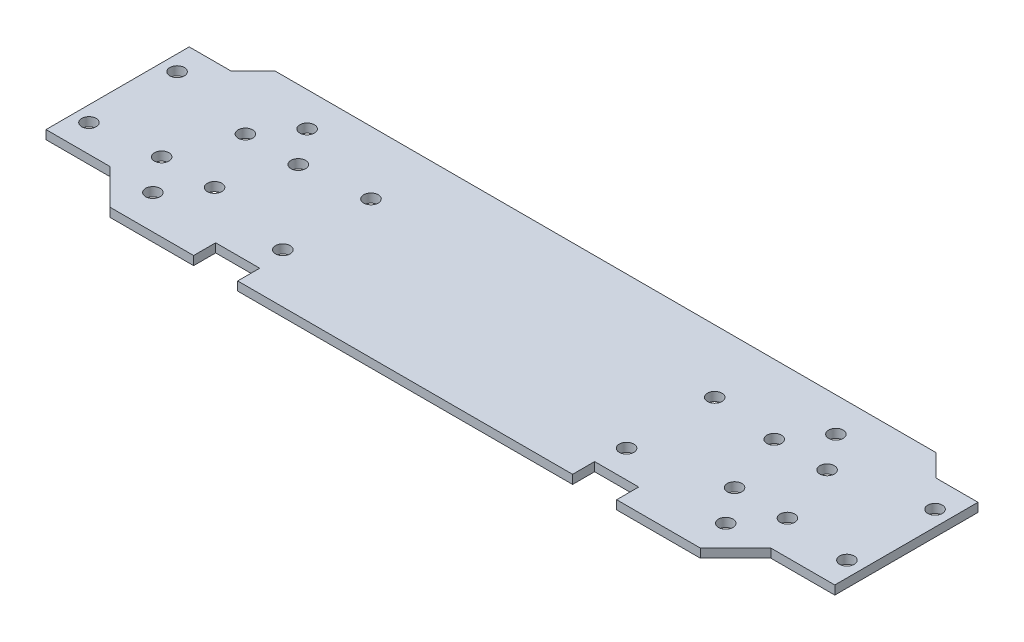
from build123d import *

# Parameters (mm, degrees)
SKETCH_1_W          = 150
SKETCH_1_H          = 45.5
EXTRUDE_1_DEPTH     = 2
CUT_EXTRUDE_1_REACH = 80.4
SKETCH_2_R          = 1.65
CUT_EXTRUDE_2_REACH = 80.4
SKETCH_4_W          = 10
SKETCH_4_H          = 5
CHAMFER_1_SIZE      = 8
SKETCH_6_W          = 14.5
SKETCH_6_H          = 32.5
EXTRUDE_2_DEPTH     = 2
CUT_EXTRUDE_3_REACH = 94.368
SKETCH_7_R          = 1.65
CHAMFER_2_SIZE      = 5


with BuildPart() as part:
    # 草图1 → 凸台-拉伸1 (new body)
    with BuildSketch(Plane(origin=(0, 0, 0), x_dir=(1, 0, 0), z_dir=(0, 1, 0))):
        Rectangle(SKETCH_1_W, SKETCH_1_H)
    extrude(amount=EXTRUDE_1_DEPTH)

    # 草图2 → 切除-拉伸1 (cut, up to next)
    with BuildSketch(Plane(origin=(0, 2, 0), x_dir=(1, 0, 0), z_dir=(0, 1, 0)), mode=Mode.PRIVATE) as cut_extrude_1_sk1:
        with Locations(Location((-60, 15, 0), (0, 0, 270))):
            Circle(SKETCH_2_R)
    cut_extrude_1_tool1 = extrude(cut_extrude_1_sk1.sketch, amount=-CUT_EXTRUDE_1_REACH, mode=Mode.PRIVATE) & part.part
    # 草图2 → 切除-拉伸1 (cut, up to next)
    with BuildSketch(Plane(origin=(0, 2, 0), x_dir=(1, 0, 0), z_dir=(0, 1, 0)), mode=Mode.PRIVATE) as cut_extrude_1_sk2:
        with Locations(Location((-66, 7, 0), (0, 0, 270))):
            Circle(SKETCH_2_R)
    cut_extrude_1_tool2 = extrude(cut_extrude_1_sk2.sketch, amount=-CUT_EXTRUDE_1_REACH, mode=Mode.PRIVATE) & part.part
    # 草图2 → 切除-拉伸1 (cut, up to next)
    with BuildSketch(Plane(origin=(0, 2, 0), x_dir=(1, 0, 0), z_dir=(0, 1, 0)), mode=Mode.PRIVATE) as cut_extrude_1_sk3:
        with Locations(Location((-54, 7, 0), (0, 0, 270))):
            Circle(SKETCH_2_R)
    cut_extrude_1_tool3 = extrude(cut_extrude_1_sk3.sketch, amount=-CUT_EXTRUDE_1_REACH, mode=Mode.PRIVATE) & part.part
    # 草图2 → 切除-拉伸1 (cut, up to next)
    with BuildSketch(Plane(origin=(0, 2, 0), x_dir=(1, 0, 0), z_dir=(0, 1, 0)), mode=Mode.PRIVATE) as cut_extrude_1_sk4:
        with Locations(Location((-71, -7, 0), (0, 0, 270))):
            Circle(SKETCH_2_R)
    cut_extrude_1_tool4 = extrude(cut_extrude_1_sk4.sketch, amount=-CUT_EXTRUDE_1_REACH, mode=Mode.PRIVATE) & part.part
    # 草图2 → 切除-拉伸1 (cut, up to next)
    with BuildSketch(Plane(origin=(0, 2, 0), x_dir=(1, 0, 0), z_dir=(0, 1, 0)), mode=Mode.PRIVATE) as cut_extrude_1_sk5:
        with Locations(Location((-59, -7, 0), (0, 0, 270))):
            Circle(SKETCH_2_R)
    cut_extrude_1_tool5 = extrude(cut_extrude_1_sk5.sketch, amount=-CUT_EXTRUDE_1_REACH, mode=Mode.PRIVATE) & part.part
    # 草图2 → 切除-拉伸1 (cut, up to next)
    with BuildSketch(Plane(origin=(0, 2, 0), x_dir=(1, 0, 0), z_dir=(0, 1, 0)), mode=Mode.PRIVATE) as cut_extrude_1_sk6:
        with Locations(Location((-65, -15, 0), (0, 0, 270))):
            Circle(SKETCH_2_R)
    cut_extrude_1_tool6 = extrude(cut_extrude_1_sk6.sketch, amount=-CUT_EXTRUDE_1_REACH, mode=Mode.PRIVATE) & part.part
    cut_extrude_1_1 = cut_extrude_1_tool1.solids().sort_by_distance((-60, 2, -15))[0]
    add(cut_extrude_1_1, mode=Mode.SUBTRACT)
    cut_extrude_1_2 = cut_extrude_1_tool2.solids().sort_by_distance((-66, 2, -7))[0]
    add(cut_extrude_1_2, mode=Mode.SUBTRACT)
    cut_extrude_1_3 = cut_extrude_1_tool3.solids().sort_by_distance((-54, 2, -7))[0]
    add(cut_extrude_1_3, mode=Mode.SUBTRACT)
    cut_extrude_1_4 = cut_extrude_1_tool4.solids().sort_by_distance((-71, 2, 7))[0]
    add(cut_extrude_1_4, mode=Mode.SUBTRACT)
    cut_extrude_1_5 = cut_extrude_1_tool5.solids().sort_by_distance((-59, 2, 7))[0]
    add(cut_extrude_1_5, mode=Mode.SUBTRACT)
    cut_extrude_1_6 = cut_extrude_1_tool6.solids().sort_by_distance((-65, 2, 15))[0]
    add(cut_extrude_1_6, mode=Mode.SUBTRACT)
    cut_extrude_1 = cut_extrude_1_1 + cut_extrude_1_2 + cut_extrude_1_3 + cut_extrude_1_4 + cut_extrude_1_5 + cut_extrude_1_6  # 切除-拉伸1 as one shape, for the pattern or mirror that repeats it

    # 草图4 → 切除-拉伸2 (cut, up to next)
    with BuildSketch(Plane(origin=(0, 2, 0), x_dir=(1, 0, 0), z_dir=(0, 1, 0)), mode=Mode.PRIVATE) as cut_extrude_2_sk1:
        with Locations((-43, -20.25)):
            Rectangle(SKETCH_4_W, SKETCH_4_H)
    cut_extrude_2_tool1 = extrude(cut_extrude_2_sk1.sketch, amount=-CUT_EXTRUDE_2_REACH, mode=Mode.PRIVATE) & part.part
    cut_extrude_2 = cut_extrude_2_tool1.solids().sort_by_distance((-43, 2, 20.25))[0]
    add(cut_extrude_2, mode=Mode.SUBTRACT)

    # 镜向1: 切除-拉伸1, 切除-拉伸2 across plane
    add(cut_extrude_1.mirror(Plane(origin=(0, 0, 0), x_dir=(0, 0, 1), z_dir=(1, 0, 0))), mode=Mode.SUBTRACT)
    add(cut_extrude_2.mirror(Plane(origin=(0, 0, 0), x_dir=(0, 0, 1), z_dir=(1, 0, 0))), mode=Mode.SUBTRACT)

    # 倒角1
    chamfer_1_edges = [part.edges().sort_by_distance(p)[0] for p in [
        (75, 1, 22.75),
        (-75, 1, 22.75),
    ]]
    chamfer(chamfer_1_edges, length=CHAMFER_1_SIZE)

    # 草图6 → 凸台-拉伸2 (add)
    with BuildSketch(Plane(origin=(0, 0, 0), x_dir=(1, 0, 0), z_dir=(0, 1, 0))):
        with Locations((-82.25, 1.5)):
            Rectangle(SKETCH_6_W, SKETCH_6_H)
    extrude_2 = extrude(amount=EXTRUDE_2_DEPTH)

    # 草图7 → 切除-拉伸3 (cut, up to next)
    with BuildSketch(Plane(origin=(0, 2, 0), x_dir=(1, 0, 0), z_dir=(0, 1, 0)), mode=Mode.PRIVATE) as cut_extrude_3_sk1:
        with Locations(Location((-86, -8.5, 0), (0, 0, 270))):
            Circle(SKETCH_7_R)
    cut_extrude_3_tool1 = extrude(cut_extrude_3_sk1.sketch, amount=-CUT_EXTRUDE_3_REACH, mode=Mode.PRIVATE) & part.part
    # 草图7 → 切除-拉伸3 (cut, up to next)
    with BuildSketch(Plane(origin=(0, 2, 0), x_dir=(1, 0, 0), z_dir=(0, 1, 0)), mode=Mode.PRIVATE) as cut_extrude_3_sk2:
        with Locations(Location((-86, 11.5, 0), (0, 0, 270))):
            Circle(SKETCH_7_R)
    cut_extrude_3_tool2 = extrude(cut_extrude_3_sk2.sketch, amount=-CUT_EXTRUDE_3_REACH, mode=Mode.PRIVATE) & part.part
    # 草图7 → 切除-拉伸3 (cut, up to next)
    with BuildSketch(Plane(origin=(0, 2, 0), x_dir=(1, 0, 0), z_dir=(0, 1, 0)), mode=Mode.PRIVATE) as cut_extrude_3_sk3:
        with Locations(Location((-39, -11.5, 0), (0, 0, 270))):
            Circle(SKETCH_7_R)
    cut_extrude_3_tool3 = extrude(cut_extrude_3_sk3.sketch, amount=-CUT_EXTRUDE_3_REACH, mode=Mode.PRIVATE) & part.part
    # 草图7 → 切除-拉伸3 (cut, up to next)
    with BuildSketch(Plane(origin=(0, 2, 0), x_dir=(1, 0, 0), z_dir=(0, 1, 0)), mode=Mode.PRIVATE) as cut_extrude_3_sk4:
        with Locations(Location((-39, 8.5, 0), (0, 0, 270))):
            Circle(SKETCH_7_R)
    cut_extrude_3_tool4 = extrude(cut_extrude_3_sk4.sketch, amount=-CUT_EXTRUDE_3_REACH, mode=Mode.PRIVATE) & part.part
    cut_extrude_3_1 = cut_extrude_3_tool1.solids().sort_by_distance((-86, 2, 8.5))[0]
    add(cut_extrude_3_1, mode=Mode.SUBTRACT)
    cut_extrude_3_2 = cut_extrude_3_tool2.solids().sort_by_distance((-86, 2, -11.5))[0]
    add(cut_extrude_3_2, mode=Mode.SUBTRACT)
    cut_extrude_3_3 = cut_extrude_3_tool3.solids().sort_by_distance((-39, 2, 11.5))[0]
    add(cut_extrude_3_3, mode=Mode.SUBTRACT)
    cut_extrude_3_4 = cut_extrude_3_tool4.solids().sort_by_distance((-39, 2, -8.5))[0]
    add(cut_extrude_3_4, mode=Mode.SUBTRACT)
    cut_extrude_3 = cut_extrude_3_1 + cut_extrude_3_2 + cut_extrude_3_3 + cut_extrude_3_4  # 切除-拉伸3 as one shape, for the pattern or mirror that repeats it

    # 镜向3: 凸台-拉伸2, 切除-拉伸3 across plane
    add(extrude_2.mirror(Plane(origin=(0, 0, 0), x_dir=(0, 0, 1), z_dir=(1, 0, 0))))
    add(cut_extrude_3.mirror(Plane(origin=(0, 0, 0), x_dir=(0, 0, 1), z_dir=(1, 0, 0))), mode=Mode.SUBTRACT)

    # 倒角2
    chamfer_2_edges = [part.edges().sort_by_distance(p)[0] for p in [
        (-75, 1, -17.75),
        (75, 1, -17.75),
    ]]
    chamfer(chamfer_2_edges, length=CHAMFER_2_SIZE - 0.0001)  # a hair under: the kernel refuses the full size


solid = part.part
